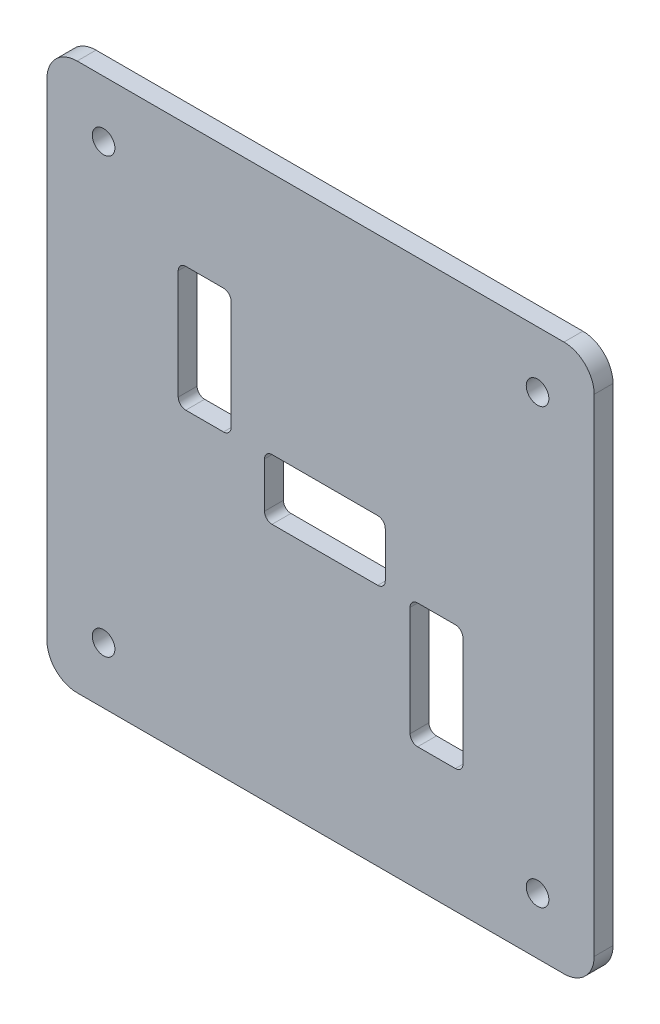
from build123d import *
from build123d.topology import SkipClean

# Parameters (mm, degrees)
SKETCH1_R                = 1.5
BOSS_EXTRUDE1_DEPTH      = 2.5
BOSS_EXTRUDE2_DEPTH      = 1.8
BOSS_EXTRUDE2_DEPTH_BACK = 2.5
SKETCH2_R                = 4.5
SKETCH2_R_2              = 1.5
SKETCH4_R                = 2.5
CUT_EXTRUDE1_DEPTH       = 2
BOSS_EXTRUDE3_START      = 0.75
SKETCH5_R                = 4.5
SKETCH5_R_2              = 2.5
BOSS_EXTRUDE3_DEPTH      = 0.75
BOSS_EXTRUDE4_DEPTH      = 2.5
CUT_EXTRUDE2_REACH       = 80.314
SKETCH7_R                = 1.5
SKETCH7_W                = 7
SKETCH7_H                = 16.5
SKETCH7_W_2              = 16
SKETCH7_H_2              = 8
CUT_EXTRUDE3_REACH       = 82.041
SKETCH9_W                = 2.5
SKETCH9_H                = 22.388822383
BOSS_EXTRUDE5_DEPTH      = 12.5
FILLET1_R                = 4
FILLET2_R                = 1
FILLET3_R                = 4
CUT_EXTRUDE4_DEPTH       = 74.103052287
CUT_EXTRUDE4_DEPTH_BACK  = 74.103052287
SKETCH10_W               = 26.624352611
SKETCH10_H               = 48.524798022
CIRPATTERN1_START        = -34.45
CIRPATTERN1_DEPTH        = 2.5


# Read off the part's stored shape, not the designer's step: CirPattern1
with BuildPart() as part:
    # Sketch1 → Boss-Extrude1 (new body)
    with BuildSketch(Plane(origin=(0, 0, 0), x_dir=(0, 0, -1), z_dir=(1, 0, 0))):
        with BuildLine():
            Line((0, 12.5), (34.45, 12.5))
            Line((34.45, 12.5), (34.45, -12.5))
            Line((34.45, -12.5), (0, -12.5))
            ThreePointArc((0, -12.5), (-12.5, 0), (0, 12.5))
        make_face()
        Circle(SKETCH1_R, mode=Mode.SUBTRACT)
    extrude(amount=BOSS_EXTRUDE1_DEPTH)

    # Sketch2 → Boss-Extrude2 (add, two sides: drawn at the far end of the back side and taken through both)
    with BuildSketch(Plane.ZY.offset(-BOSS_EXTRUDE2_DEPTH_BACK)):
        Circle(SKETCH2_R)
        Circle(SKETCH2_R_2, mode=Mode.SUBTRACT)
    extrude(amount=BOSS_EXTRUDE2_DEPTH + BOSS_EXTRUDE2_DEPTH_BACK)

    # Sketch4 → Cut-Extrude1 (cut)
    with BuildSketch(Plane(origin=(2.5, 0, 0), x_dir=(0, 0, -1), z_dir=(1, 0, 0))):
        Circle(SKETCH4_R)
    extrude(amount=-CUT_EXTRUDE1_DEPTH, mode=Mode.SUBTRACT)

    # Sketch5 → Boss-Extrude3 (add)
    with SkipClean():  # the faces are left unmerged after this step: merging them gives an invalid solid
        with BuildSketch(Plane(origin=(2.5, 0, 0), x_dir=(0, 0, -1), z_dir=(1, 0, 0)).offset(BOSS_EXTRUDE3_START)):
            with Locations(Location((0, 0, 0), (0, 0, 180))):
                Circle(SKETCH5_R)
            Circle(SKETCH5_R_2, mode=Mode.SUBTRACT)
        extrude(amount=-BOSS_EXTRUDE3_DEPTH)

    # Sketch6 → Boss-Extrude4 (add)
    with SkipClean():  # the faces are left unmerged after this step: merging them gives an invalid solid
        with BuildSketch(Plane(origin=(0, 0, -34.45), x_dir=(-1, 0, 0), z_dir=(0, 0, -1))):
            Polygon((-8.812505246, 36.25), (53.321583376, 36.25), (53.321583376, -36.25), (6.25, -36.25), (-19.178416624, -36.25), (-19.178416624, 36.25), align=None)
        extrude(amount=-BOSS_EXTRUDE4_DEPTH)
    add(part.part.scale(1), mode=Mode.REPLACE)  # the faces are merged on a copy

    # Sketch7 → Cut-Extrude2 (cut, up to next)
    with BuildSketch(Plane.XY.offset(-31.95), mode=Mode.PRIVATE) as cut_extrude2_sk1:
        with Locations((11.678416624, -28.75)):
            Circle(SKETCH7_R)
    cut_extrude2_tool1 = extrude(cut_extrude2_sk1.sketch, amount=-CUT_EXTRUDE2_REACH, mode=Mode.PRIVATE) & part.part
    # Sketch7 → Cut-Extrude2 (cut, up to next)
    with BuildSketch(Plane.XY.offset(-31.95), mode=Mode.PRIVATE) as cut_extrude2_sk2:
        with Locations(Location((11.678416624, 28.75, 0), (0, 0, 180))):
            Circle(SKETCH7_R)
    cut_extrude2_tool2 = extrude(cut_extrude2_sk2.sketch, amount=-CUT_EXTRUDE2_REACH, mode=Mode.PRIVATE) & part.part
    # Sketch7 → Cut-Extrude2 (cut, up to next)
    with BuildSketch(Plane.XY.offset(-31.95), mode=Mode.PRIVATE) as cut_extrude2_sk3:
        with Locations((-45.821583376, 28.75)):
            Circle(SKETCH7_R)
    cut_extrude2_tool3 = extrude(cut_extrude2_sk3.sketch, amount=-CUT_EXTRUDE2_REACH, mode=Mode.PRIVATE) & part.part
    # Sketch7 → Cut-Extrude2 (cut, up to next)
    with BuildSketch(Plane.XY.offset(-31.95), mode=Mode.PRIVATE) as cut_extrude2_sk4:
        with Locations(Location((-45.821583376, -28.75, 0), (0, 0, 180))):
            Circle(SKETCH7_R)
    cut_extrude2_tool4 = extrude(cut_extrude2_sk4.sketch, amount=-CUT_EXTRUDE2_REACH, mode=Mode.PRIVATE) & part.part
    # Sketch7 → Cut-Extrude2 (cut, up to next)
    with BuildSketch(Plane.XY.offset(-31.95), mode=Mode.PRIVATE) as cut_extrude2_sk5:
        with Locations((-1.711858899, -11.632438111)):
            Rectangle(SKETCH7_W, SKETCH7_H)
    cut_extrude2_tool5 = extrude(cut_extrude2_sk5.sketch, amount=-CUT_EXTRUDE2_REACH, mode=Mode.PRIVATE) & part.part
    # Sketch7 → Cut-Extrude2 (cut, up to next)
    with BuildSketch(Plane.XY.offset(-31.95), mode=Mode.PRIVATE) as cut_extrude2_sk6:
        with Locations((-16.5, 0)):
            Rectangle(SKETCH7_W_2, SKETCH7_H_2)
    cut_extrude2_tool6 = extrude(cut_extrude2_sk6.sketch, amount=-CUT_EXTRUDE2_REACH, mode=Mode.PRIVATE) & part.part
    add(cut_extrude2_tool1.solids().sort_by_distance((11.678417, -28.75, -31.95))[0], mode=Mode.SUBTRACT)
    add(cut_extrude2_tool2.solids().sort_by_distance((11.678417, 28.75, -31.95))[0], mode=Mode.SUBTRACT)
    add(cut_extrude2_tool3.solids().sort_by_distance((-45.821583, 28.75, -31.95))[0], mode=Mode.SUBTRACT)
    add(cut_extrude2_tool4.solids().sort_by_distance((-45.821583, -28.75, -31.95))[0], mode=Mode.SUBTRACT)
    add(cut_extrude2_tool5.solids().sort_by_distance((-1.711859, -11.632438, -31.95))[0], mode=Mode.SUBTRACT)
    add(cut_extrude2_tool6.solids().sort_by_distance((-16.5, 0, -31.95))[0], mode=Mode.SUBTRACT)

    # Sketch9 → Cut-Extrude3 (cut, up to next)
    with BuildSketch(Plane.XZ.offset(12.5), mode=Mode.PRIVATE) as cut_extrude3_sk1:
        with Locations((1.25, -20.755588809)):
            Rectangle(SKETCH9_W, SKETCH9_H)
    cut_extrude3_tool1 = extrude(cut_extrude3_sk1.sketch, amount=-CUT_EXTRUDE3_REACH, mode=Mode.PRIVATE) & part.part
    add(cut_extrude3_tool1.solids().sort_by_distance((1.25, -12.5, -20.755589))[0], mode=Mode.SUBTRACT)


with BuildPart() as cut_extrude3_piece_1:
    # of the separate pieces the step leaves, piece 1, a body of its own (cut_extrude3_pieces)
    add(part.part.solids().sort_by_distance((-53.321583376, 36.25, -31.95))[0])



with BuildPart() as cut_extrude3_piece_2:
    # of the separate pieces the step leaves, piece 2, a body of its own (cut_extrude3_pieces)
    add(part.part.solids().sort_by_distance((0, 12.5, 0))[0])


with BuildPart() as cut_extrude3_piece_1_1:
    add(cut_extrude3_piece_1.part)

    add(cut_extrude3_piece_2.part)  # Boss-Extrude5 merges Cut-Extrude3 piece 2
    # Sketch8 → Boss-Extrude5 (add, symmetric)
    with BuildSketch(Plane(origin=(0, 0, 0), x_dir=(1, 0, 0), z_dir=(0, 1, 0))):
        with BuildLine():
            Line((13.243344962, 31.95), (10.743344962, 31.95))
            Line((10.743344962, 31.95), (10.743344962, 24.009277686))
            ThreePointArc((10.743344962, 24.009277686), (9.553562393, 20.771648442), (6.550447712, 19.074849133))
            ThreePointArc((6.550447712, 19.074849133), (1.858764487, 16.423986378), (0, 11.365927519))
            Line((0, 11.365927519), (0, 9.071657281))
            Line((0, 9.071657281), (2.5, 9.071657281))
            Line((2.5, 9.071657281), (2.5, 11.666723736))
            ThreePointArc((2.5, 11.666723736), (3.641866376, 14.847101848), (6.545921975, 16.574853229))
            ThreePointArc((6.545921975, 16.574853229), (11.35315475, 19.434889059), (13.243344962, 24.69953272))
            Line((13.243344962, 24.69953272), (13.243344962, 31.95))
        make_face()
    extrude(amount=BOSS_EXTRUDE5_DEPTH, both=True)

    # Fillet1
    fillet1_edges = [cut_extrude3_piece_1_1.edges().sort_by_distance(p)[0] for p in [
        (11.993344962, -12.5, -31.95),
        (13.243344962, 0, -31.95),
        (10.743344962, 0, -31.95),
        (11.993344962, 12.5, -31.95),
    ]]
    fillet(fillet1_edges, radius=FILLET1_R)

    # Fillet2
    fillet2_edges = [cut_extrude3_piece_1_1.edges().sort_by_distance(p)[0] for p in [
        (-5.211858899, -19.882438111, -33.2),
        (-5.211858899, -3.382438111, -33.2),
        (1.788141101, -3.382438111, -33.2),
        (1.788141101, -19.882438111, -33.2),
        (-8.5, 4, -33.2),
        (-8.5, -4, -33.2),
        (-24.5, -4, -33.2),
        (-24.5, 4, -33.2),
    ]]
    fillet(fillet2_edges, radius=FILLET2_R)

    # Fillet3
    fillet3_edges = [cut_extrude3_piece_1_1.edges().sort_by_distance(p)[0] for p in [
        (19.178416624, 36.25, -33.2),
        (-53.321583376, 36.25, -33.2),
        (-53.321583376, -36.25, -33.2),
        (19.178416624, -36.25, -33.2),
    ]]
    fillet(fillet3_edges, radius=FILLET3_R)

    # Sketch10 → Cut-Extrude4 (cut, two sides: drawn at the far end of the back side and taken through both)
    with BuildSketch(Plane(origin=(0, 0, 0), x_dir=(1, 0, 0), z_dir=(0, 1, 0)).offset(-CUT_EXTRUDE4_DEPTH_BACK)):
        with Locations((4.711977851, 7.687600989)):
            Rectangle(SKETCH10_W, SKETCH10_H)
    extrude(amount=CUT_EXTRUDE4_DEPTH + CUT_EXTRUDE4_DEPTH_BACK, mode=Mode.SUBTRACT)

    # CirPattern1 outline → CirPattern1 (cut)
    with BuildSketch(Plane.XY.offset(CIRPATTERN1_START)):
        with BuildLine():
            ThreePointArc((-28.931307853, 18.882438111), (-29.224201072, 19.589544892), (-29.931307853, 19.882438111))
            Line((-29.931307853, 19.882438111), (-34.931307853, 19.882438111))
            ThreePointArc((-34.931307853, 19.882438111), (-35.638414634, 19.589544892), (-35.931307853, 18.882438111))
            Line((-35.931307853, 18.882438111), (-35.931307853, 4.382438111))
            ThreePointArc((-35.931307853, 4.382438111), (-35.638414634, 3.67533133), (-34.931307853, 3.382438111))
            Line((-34.931307853, 3.382438111), (-29.931307853, 3.382438111))
            ThreePointArc((-29.931307853, 3.382438111), (-29.224201072, 3.67533133), (-28.931307853, 4.382438111))
            Line((-28.931307853, 4.382438111), (-28.931307853, 18.882438111))
        make_face()
    extrude(amount=CIRPATTERN1_DEPTH, mode=Mode.SUBTRACT)


solid = cut_extrude3_piece_1_1.part
